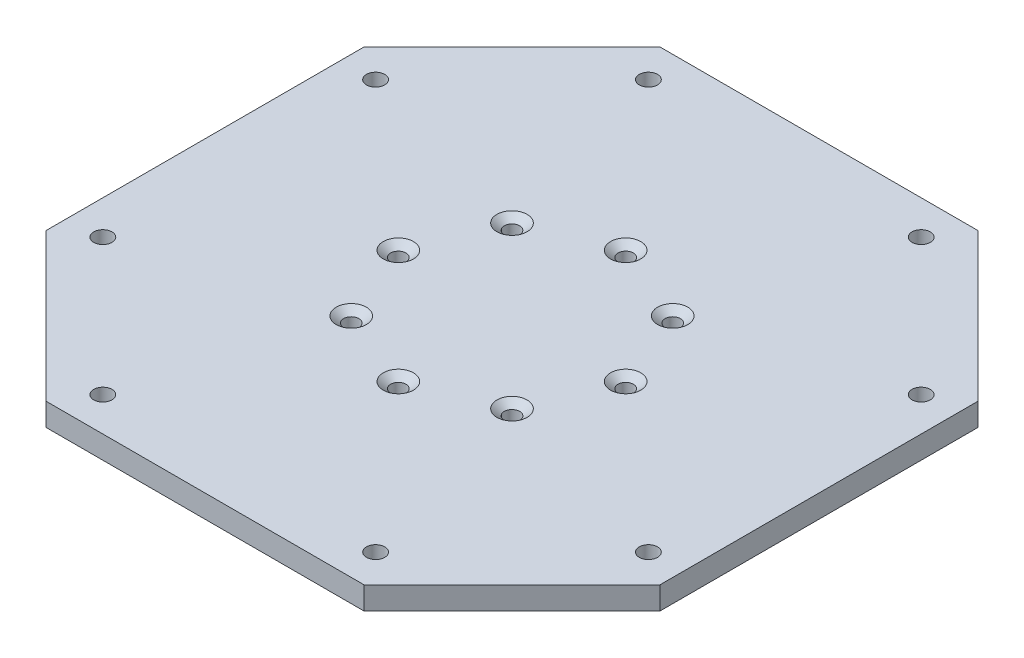
from build123d import *

# Parameters (mm, degrees)
BOSS_EXTRUDE1_DEPTH                               = 6.35
F_7_0_201_DIAMETER_HOLE1_D                        = 5.1054
CIRPATTERN1_COUNT                                 = 4
CSK_FOR_8_FLAT_HEAD_MACHINE_SCREW_100_D           = 4.3053
CSK_FOR_8_FLAT_HEAD_MACHINE_SCREW_100_CSINK_D     = 8.4328
CSK_FOR_8_FLAT_HEAD_MACHINE_SCREW_100_CSINK_ANGLE = 100
CIRPATTERN2_COUNT                                 = 8


with BuildPart() as part:
    # Sketch1 → Boss-Extrude1 (new body)
    with BuildSketch(Plane(origin=(0, 0, 0), x_dir=(1, 0, 0), z_dir=(0, 1, 0))):
        Polygon((-85.725, 44.45), (-44.45, 85.725), (44.45, 85.725), (85.725, 44.45), (85.725, -44.45), (44.45, -85.725), (-44.45, -85.725), (-85.725, -44.45), align=None)
    extrude(amount=BOSS_EXTRUDE1_DEPTH)

    # #7 (0.201) Diameter Hole1 (through all)
    with Locations(Plane(origin=(0, 6.35, 0), x_dir=(-1, 0, 0), z_dir=(0, 1, 0))):
        with Locations((38.1, -76.2), (-38.1, -76.2)):
            f_7_0_201_diameter_hole1 = Hole(F_7_0_201_DIAMETER_HOLE1_D / 2)

    # CirPattern1: #7 (0.201) Diameter Hole1 ×4 about axis
    cirpattern1_axis = Axis((0, 0, 0), (0, 1, 0))
    for i in range(1, CIRPATTERN1_COUNT):
        add(f_7_0_201_diameter_hole1.rotate(cirpattern1_axis, i * 360 / CIRPATTERN1_COUNT), mode=Mode.SUBTRACT)

    # CSK for #8 Flat Head Machine Screw (100)1 (through all)
    with Locations(Plane(origin=(0, 6.35, 0), x_dir=(-1, 0, 0), z_dir=(0, 1, 0))):
        with Locations((0, 31.75)):
            csk_for_8_flat_head_machine_screw_100 = CounterSinkHole(CSK_FOR_8_FLAT_HEAD_MACHINE_SCREW_100_D / 2, CSK_FOR_8_FLAT_HEAD_MACHINE_SCREW_100_CSINK_D / 2, counter_sink_angle=CSK_FOR_8_FLAT_HEAD_MACHINE_SCREW_100_CSINK_ANGLE)

    # CirPattern2: CSK for #8 Flat Head Machine Screw (100)1 ×8 about axis
    cirpattern2_axis = Axis((0, 0, 0), (0, 1, 0))
    for i in range(1, CIRPATTERN2_COUNT):
        add(csk_for_8_flat_head_machine_screw_100.rotate(cirpattern2_axis, i * 360 / CIRPATTERN2_COUNT), mode=Mode.SUBTRACT)


solid = part.part
